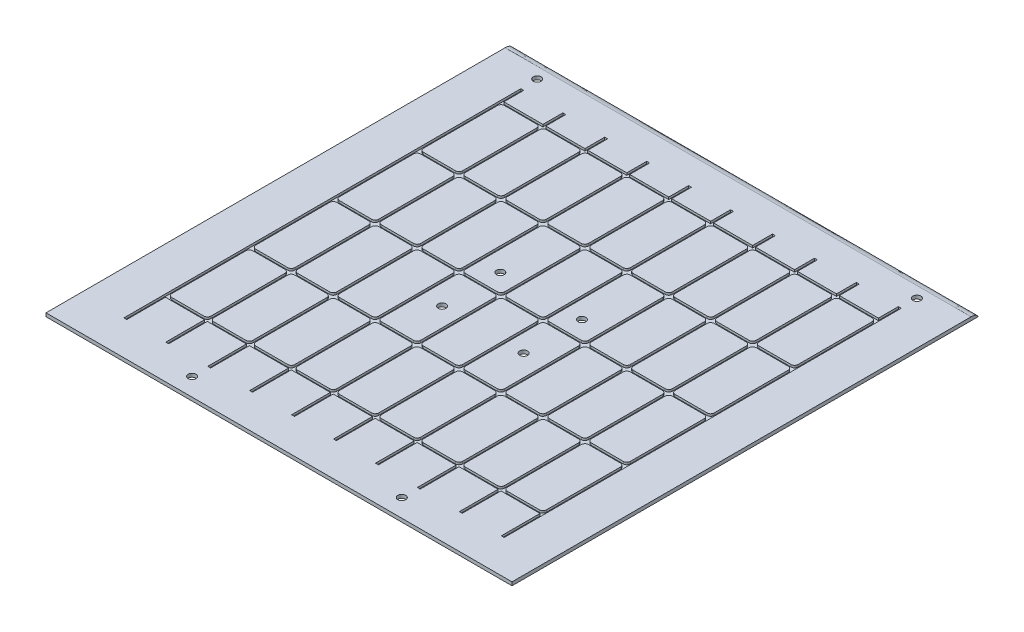
from build123d import *

# Parameters (mm, degrees)
SKETCH1_W               = 200
SKETCH1_H               = 200
BOSS_EXTRUDE1_DEPTH     = 1.48
SKETCH3_W               = 1.24
SKETCH3_H               = 170.4
CUT_EXTRUDE1_DEPTH      = 0.96
SKETCH4_W               = 163.24
SKETCH4_H               = 1.24
CUT_EXTRUDE_THIN1_DEPTH = 0.96
FILLET1_START           = -101
FILLET1_DEPTH           = 202
FILLET2_R               = 1.5
SKETCH5_R               = 1.675
CUT_EXTRUDE2_DEPTH      = 10
SKETCH6_R               = 1.675
CUT_EXTRUDE3_DEPTH      = 10


with BuildPart() as part:
    # Sketch1 → Boss-Extrude1 (new body)
    with BuildSketch(Plane(origin=(0, 0, 0), x_dir=(1, 0, 0), z_dir=(0, 1, 0))):
        Rectangle(SKETCH1_W, SKETCH1_H)
    extrude(amount=BOSS_EXTRUDE1_DEPTH)

    # Sketch3 → Cut-Extrude1 (cut)
    with BuildSketch(Plane(origin=(0, 1.48, 0), x_dir=(1, 0, 0), z_dir=(0, 1, 0))):
        with Locations((63.22, 0)):
            Rectangle(SKETCH3_W, SKETCH3_H)
        with Locations((81.22, 0)):
            Rectangle(SKETCH3_W, SKETCH3_H)
        with Locations((45.22, 0)):
            Rectangle(SKETCH3_W, SKETCH3_H)
        with Locations((27.22, 0)):
            Rectangle(SKETCH3_W, SKETCH3_H)
        with Locations((9.22, 0)):
            Rectangle(SKETCH3_W, SKETCH3_H)
        with Locations((-8.78, 0)):
            Rectangle(SKETCH3_W, SKETCH3_H)
        with Locations((-26.78, 0)):
            Rectangle(SKETCH3_W, SKETCH3_H)
        with Locations((-44.78, 0)):
            Rectangle(SKETCH3_W, SKETCH3_H)
        with Locations((-62.78, 0)):
            Rectangle(SKETCH3_W, SKETCH3_H)
        with Locations((-80.78, 0)):
            Rectangle(SKETCH3_W, SKETCH3_H)
    extrude(amount=-CUT_EXTRUDE1_DEPTH, mode=Mode.SUBTRACT)

    # Sketch4 → Cut-Extrude-Thin1 (cut)
    with BuildSketch(Plane(origin=(0, 1.48, 0), x_dir=(1, 0, 0), z_dir=(0, 1, 0))):
        with Locations((0.22, 76.05)):
            Rectangle(SKETCH4_W, SKETCH4_H)
        with Locations((0.22, 40.05)):
            Rectangle(SKETCH4_W, SKETCH4_H)
        with Locations((0.22, 4.05)):
            Rectangle(SKETCH4_W, SKETCH4_H)
        with Locations((0.22, -31.95)):
            Rectangle(SKETCH4_W, SKETCH4_H)
        with Locations((0.22, -67.95)):
            Rectangle(SKETCH4_W, SKETCH4_H)
    extrude(amount=-CUT_EXTRUDE_THIN1_DEPTH, mode=Mode.SUBTRACT)

    # Fillet1: read off the stored shape, not the designer's step
    # Fillet1 outline → Fillet1 (cut)
    with BuildSketch(Plane.YZ.offset(FILLET1_START)):
        with BuildLine():
            add(Edge.make_bspline(
                [(0, -100), (1.48, -99.739523896), (1.48, -97.04541035)],
                knots=[0, 0, 0, 1, 1, 1], degree=2, weights=[1, 0.765941686, 1]))
            Line((0, -100), (1.48, -100))
            Line((1.48, -100), (1.48, -97.04541035))
        make_face()
    extrude(amount=FILLET1_DEPTH, mode=Mode.SUBTRACT)

    # Fillet2
    fillet2_edges = [part.edges().sort_by_distance(p)[0] for p in [
        (63.84, 1, -75.43),
        (80.6, 1, -75.43),
        (62.6, 1, -75.43),
        (45.84, 1, -75.43),
        (44.6, 1, -75.43),
        (27.84, 1, -75.43),
        (26.6, 1, -75.43),
        (9.84, 1, -75.43),
        (8.6, 1, -75.43),
        (-8.16, 1, -75.43),
        (-9.4, 1, -75.43),
        (-26.16, 1, -75.43),
        (-27.4, 1, -75.43),
        (-44.16, 1, -75.43),
        (-45.4, 1, -75.43),
        (-62.16, 1, -75.43),
        (-63.4, 1, -75.43),
        (-80.16, 1, -75.43),
        (63.84, 1, -39.43),
        (80.6, 1, -39.43),
        (62.6, 1, -39.43),
        (45.84, 1, -39.43),
        (44.6, 1, -39.43),
        (27.84, 1, -39.43),
        (26.6, 1, -39.43),
        (9.84, 1, -39.43),
        (8.6, 1, -39.43),
        (-8.16, 1, -39.43),
        (-9.4, 1, -39.43),
        (-26.16, 1, -39.43),
        (-27.4, 1, -39.43),
        (-44.16, 1, -39.43),
        (-45.4, 1, -39.43),
        (-62.16, 1, -39.43),
        (-63.4, 1, -39.43),
        (-80.16, 1, -39.43),
        (63.84, 1, -40.67),
        (62.6, 1, -40.67),
        (45.84, 1, -40.67),
        (44.6, 1, -40.67),
        (27.84, 1, -40.67),
        (26.6, 1, -40.67),
        (9.84, 1, -40.67),
        (8.6, 1, -40.67),
        (-8.16, 1, -40.67),
        (-9.4, 1, -40.67),
        (-26.16, 1, -40.67),
        (-27.4, 1, -40.67),
        (-44.16, 1, -40.67),
        (-45.4, 1, -40.67),
        (-62.16, 1, -40.67),
        (-63.4, 1, -40.67),
        (-80.16, 1, -40.67),
        (80.6, 1, -40.67),
        (63.84, 1, -3.43),
        (80.6, 1, -3.43),
        (62.6, 1, -3.43),
        (45.84, 1, -3.43),
        (44.6, 1, -3.43),
        (27.84, 1, -3.43),
        (26.6, 1, -3.43),
        (9.84, 1, -3.43),
        (8.6, 1, -3.43),
        (-8.16, 1, -3.43),
        (-9.4, 1, -3.43),
        (-26.16, 1, -3.43),
        (-27.4, 1, -3.43),
        (-44.16, 1, -3.43),
        (-45.4, 1, -3.43),
        (-62.16, 1, -3.43),
        (-63.4, 1, -3.43),
        (-80.16, 1, -3.43),
        (63.84, 1, -4.67),
        (62.6, 1, -4.67),
        (45.84, 1, -4.67),
        (44.6, 1, -4.67),
        (27.84, 1, -4.67),
        (26.6, 1, -4.67),
        (9.84, 1, -4.67),
        (8.6, 1, -4.67),
        (-8.16, 1, -4.67),
        (-9.4, 1, -4.67),
        (-26.16, 1, -4.67),
        (-27.4, 1, -4.67),
        (-44.16, 1, -4.67),
        (-45.4, 1, -4.67),
        (-62.16, 1, -4.67),
        (-63.4, 1, -4.67),
        (-80.16, 1, -4.67),
        (80.6, 1, -4.67),
        (63.84, 1, 32.57),
        (80.6, 1, 32.57),
        (62.6, 1, 32.57),
        (45.84, 1, 32.57),
        (44.6, 1, 32.57),
        (27.84, 1, 32.57),
        (26.6, 1, 32.57),
        (9.84, 1, 32.57),
        (8.6, 1, 32.57),
        (-8.16, 1, 32.57),
        (-9.4, 1, 32.57),
        (-26.16, 1, 32.57),
        (-27.4, 1, 32.57),
        (-44.16, 1, 32.57),
        (-45.4, 1, 32.57),
        (-62.16, 1, 32.57),
        (-63.4, 1, 32.57),
        (-80.16, 1, 32.57),
        (63.84, 1, 31.33),
        (62.6, 1, 31.33),
        (45.84, 1, 31.33),
        (44.6, 1, 31.33),
        (27.84, 1, 31.33),
        (26.6, 1, 31.33),
        (9.84, 1, 31.33),
        (8.6, 1, 31.33),
        (-8.16, 1, 31.33),
        (-9.4, 1, 31.33),
        (-26.16, 1, 31.33),
        (-27.4, 1, 31.33),
        (-44.16, 1, 31.33),
        (-45.4, 1, 31.33),
        (-62.16, 1, 31.33),
        (-63.4, 1, 31.33),
        (-80.16, 1, 31.33),
        (80.6, 1, 31.33),
        (63.84, 1, 67.33),
        (62.6, 1, 67.33),
        (45.84, 1, 67.33),
        (44.6, 1, 67.33),
        (27.84, 1, 67.33),
        (26.6, 1, 67.33),
        (9.84, 1, 67.33),
        (8.6, 1, 67.33),
        (-8.16, 1, 67.33),
        (-9.4, 1, 67.33),
        (-26.16, 1, 67.33),
        (-27.4, 1, 67.33),
        (-44.16, 1, 67.33),
        (-45.4, 1, 67.33),
        (-62.16, 1, 67.33),
        (-63.4, 1, 67.33),
        (-80.16, 1, 67.33),
        (80.6, 1, 67.33),
    ]]
    fillet(fillet2_edges, radius=FILLET2_R)

    # Sketch5 → Cut-Extrude2 (cut)
    with BuildSketch(Plane(origin=(0, 1.48, 0), x_dir=(1, 0, 0), z_dir=(0, 1, 0))):
        with Locations(Location((81.5, 92.3, 0), (0, 0, 270))):
            Circle(SKETCH5_R)
        with Locations(Location((-81.5, 92.3, 0), (0, 0, 270))):
            Circle(SKETCH5_R)
        with Locations(Location((-45, -92.3, 0), (0, 0, 270))):
            Circle(SKETCH5_R)
        with Locations(Location((45, -92.3, 0), (0, 0, 270))):
            Circle(SKETCH5_R)
    extrude(amount=-CUT_EXTRUDE2_DEPTH, mode=Mode.SUBTRACT)

    # Sketch6 → Cut-Extrude3 (cut)
    with BuildSketch(Plane(origin=(0, 1.48, 0), x_dir=(1, 0, 0), z_dir=(0, 1, 0))):
        with Locations(Location((-17.5, 12.5, 0), (0, 0, 270))):
            Circle(SKETCH6_R)
        with Locations(Location((-17.5, -12.5, 0), (0, 0, 270))):
            Circle(SKETCH6_R)
        with Locations(Location((17.5, -12.5, 0), (0, 0, 270))):
            Circle(SKETCH6_R)
        with Locations(Location((17.5, 12.5, 0), (0, 0, 270))):
            Circle(SKETCH6_R)
    extrude(amount=-CUT_EXTRUDE3_DEPTH, mode=Mode.SUBTRACT)


solid = part.part
